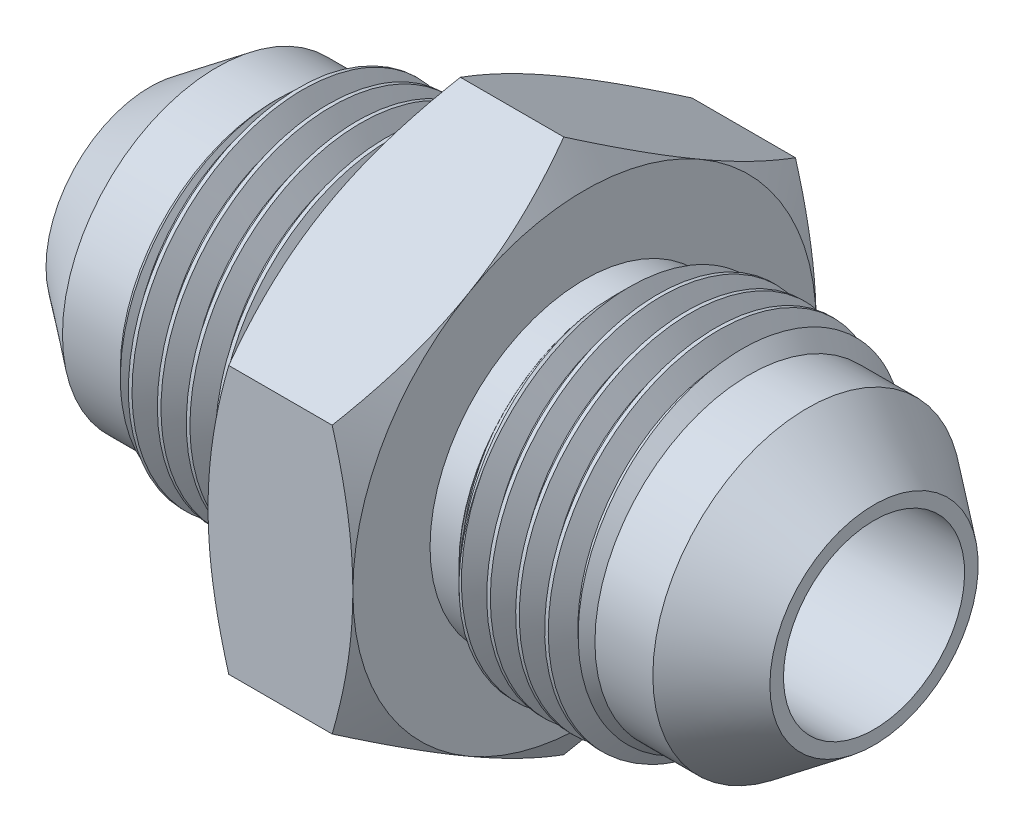
from build123d import *

# Parameters (mm, degrees)
SKETCH6_W         = 39.6875
SKETCH6_H         = 9.525
CUT_SWEEP1_PITCH  = 1.5875
CIRPATTERN1_COUNT = 2
EXTRUDE1_DEPTH    = 7.9375
SKETCH7_W         = 39.6875
SKETCH7_H         = 4.9657


with BuildPart() as part:
    # Sketch6 → Revolve3 (revolve)
    with BuildSketch(Plane.XY, mode=Mode.PRIVATE) as revolve3_sk:
        with Locations((0, 4.7625)):
            Rectangle(SKETCH6_W, SKETCH6_H)
    revolve(revolve3_sk.sketch.rotate(Axis((-19.84375, 0, 0), (1, 0, 0)), 90), axis=Axis((-19.84375, 0, 0), (1, 0, 0)))

    # Cut-Sweep1: the profile of Sketch15 profile screwed along a right-hand helix of 11 turns, 8 arcs to a turn; built about Z, then put on its axis
    cut_sweep1_z = Axis((0, 0, 0), (0, 0, 1))
    cut_sweep1_corners = [(9.5253, 0, -1.389235705), (9.5253, 0, 0.000173205), (8.493888504, 0, -0.5953125), (8.493888504, 0, -0.79375)]
    with BuildLine(mode=Mode.PRIVATE) as cut_sweep1_profile:
        Line(cut_sweep1_corners[0], cut_sweep1_corners[1])
        Line(cut_sweep1_corners[1], cut_sweep1_corners[2])
        Line(cut_sweep1_corners[2], cut_sweep1_corners[3])
        Line(cut_sweep1_corners[3], cut_sweep1_corners[0])
    cut_sweep1_cap = Face(cut_sweep1_profile.wire())
    cut_sweep1_turn_angles = [0, 22.5, 45, 67.5, 90, 112.5, 135, 157.5, 180, 202.5, 225, 247.5, 270, 292.5, 315, 337.5, 360]
    cut_sweep1_turn_weights = [1, 0.9238795325112867, 1, 0.9238795325112867, 1, 0.9238795325112867, 1, 0.9238795325112867, 1, 0.9238795325112867, 1, 0.9238795325112867, 1, 0.9238795325112867, 1, 0.9238795325112867, 1]
    cut_sweep1_turn_rails = [Edge.make_bspline([Vector(p[0], p[1], 0).rotate(cut_sweep1_z, cut_sweep1_turn_angles[k]) / cut_sweep1_turn_weights[k] + Vector(0, 0, p[2] + CUT_SWEEP1_PITCH * cut_sweep1_turn_angles[k] / 360) for k in range(17)], [0, 0, 0, 1, 1, 2, 2, 3, 3, 4, 4, 5, 5, 6, 6, 7, 7, 8, 8, 8], 2, cut_sweep1_turn_weights) for p in cut_sweep1_corners]
    cut_sweep1_turn_sides = [Face.make_surface_from_curves(cut_sweep1_turn_rails[p[0]], cut_sweep1_turn_rails[p[1]]) for p in [(0, 1), (1, 2), (2, 3), (3, 0)]]
    cut_sweep1 = Plane(origin=(-19.84375, 0, 0), x_dir=(0, 1, 0), z_dir=(1, 0, 0)) * Solid(Shell([*[p.moved(Location((0, 0, CUT_SWEEP1_PITCH * i))) for i in range(11) for p in cut_sweep1_turn_sides], cut_sweep1_cap, cut_sweep1_cap.rotate(cut_sweep1_z, 3960).moved(Location((0, 0, CUT_SWEEP1_PITCH * 3960 / 360)))]))
    add(cut_sweep1, mode=Mode.SUBTRACT)

    # CirPattern1: Cut-Sweep1 ×2 about axis
    cirpattern1_axis = Axis((0, 0, 9.525), (0, 0, -1))
    for i in range(1, CIRPATTERN1_COUNT):
        add(cut_sweep1.rotate(cirpattern1_axis, i * 360 / CIRPATTERN1_COUNT), mode=Mode.SUBTRACT)

    # Sketch12 → Extrude1 (add)
    with BuildSketch(Plane(origin=(-3.96875, 0, 0), x_dir=(0, 0, -1), z_dir=(1, 0, 0))):
        Polygon((0, 14.664696837), (-12.7, 7.332348419), (-12.7, -7.332348419), (0, -14.664696837), (12.7, -7.332348419), (12.7, 7.332348419), align=None)
    extrude(amount=EXTRUDE1_DEPTH)

    # Sketch10 → Cut-Revolve6 (revolve, cut)
    with BuildSketch(Plane.XY, mode=Mode.PRIVATE) as cut_revolve6_sk:
        Polygon((-6.612761496, 9.525), (-5.55625, 8.468488504), (-3.96875, 8.468488504), (-3.96875, 9.525), align=None)
        Polygon((6.612761496, 9.525), (3.96875, 9.525), (3.96875, 8.468488504), (5.55625, 8.468488504), align=None)
        Polygon((-19.84375, 5.710555), (-19.84375, 9.525), (-11.952337129, 9.525), (-13.008848626, 8.468488504), (-16.183848626, 8.468488504), align=None)
        Polygon((19.84375, 9.525), (11.952337129, 9.525), (13.008848626, 8.468488504), (16.183848626, 8.468488504), (19.84375, 5.710555), align=None)
    revolve(cut_revolve6_sk.sketch.rotate(Axis((-19.84375, 0, 0), (1, 0, 0)), 90), axis=Axis((-19.84375, 0, 0), (1, 0, 0)), mode=Mode.SUBTRACT)

    # Sketch7 → Cut-Revolve5 (revolve, cut)
    with BuildSketch(Plane.XY, mode=Mode.PRIVATE) as cut_revolve5_sk:
        with Locations((0, 2.48285)):
            Rectangle(SKETCH7_W, SKETCH7_H)
    revolve(cut_revolve5_sk.sketch.rotate(Axis((19.84375, 0, 0), (-1, 0, 0)), 354.041901606), axis=Axis((19.84375, 0, 0), (-1, 0, 0)), mode=Mode.SUBTRACT)

    # Sketch13 → Cut-Revolve7 (revolve, cut)
    with BuildSketch(Plane.XY, mode=Mode.PRIVATE) as cut_revolve7_sk:
        Polygon((-3.96875, 14.664696837), (-3.96875, 12.7), (-2.834431752, 14.664696837), align=None)
        Polygon((2.834431752, 14.664696837), (3.96875, 12.7), (3.96875, 14.664696837), align=None)
    revolve(cut_revolve7_sk.sketch.rotate(Axis((-19.84375, 0, 0), (1, 0, 0)), 5.958098394), axis=Axis((-19.84375, 0, 0), (1, 0, 0)), mode=Mode.SUBTRACT)


solid = part.part
